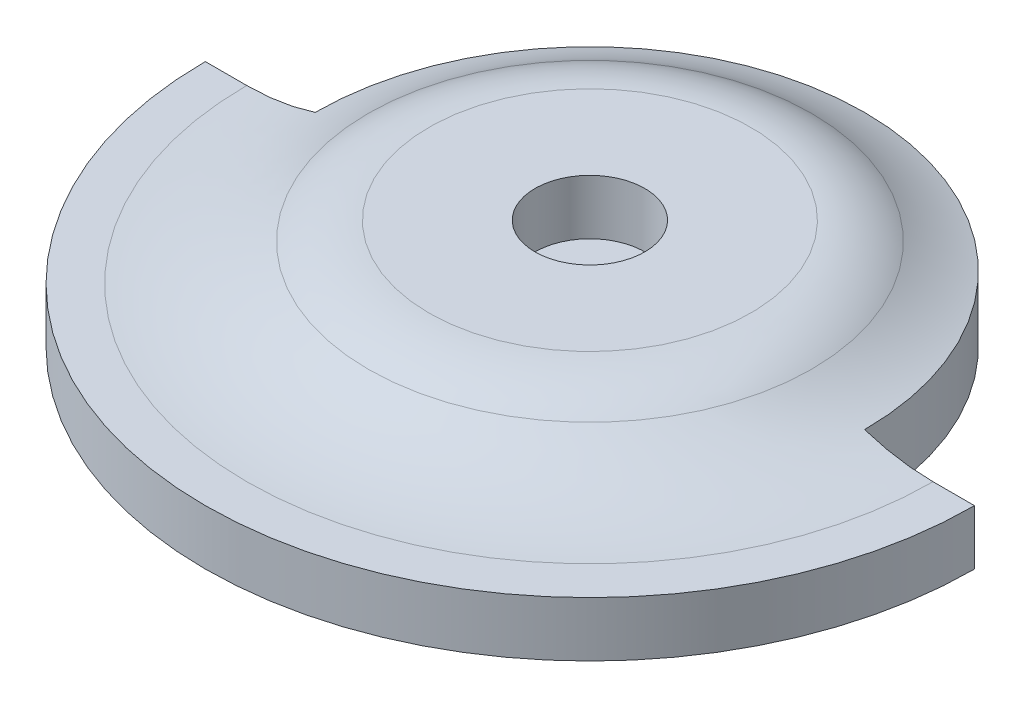
from build123d import *

# Parameters (mm, degrees)
BOSS_EXTRUDE1_DEPTH = 0.5
SKETCH2_R           = 1.8
SKETCH2_R_2         = 0.5
BOSS_EXTRUDE2_DEPTH = 0.5
FILLET2_START       = 0.5
FILLET2_2_DEPTH     = 0.5
FILLET3_R           = 1


with BuildPart() as part:
    # Sketch1 → Boss-Extrude1 (new body)
    with BuildSketch(Plane(origin=(0, 0, 0), x_dir=(1, 0, 0), z_dir=(0, 1, 0))):
        with BuildLine():
            Line((-3.5, 0), (-2.5, 0))
            ThreePointArc((-2.5, 0), (0, 2.5), (2.5, 0))
            Line((2.5, 0), (3.5, 0))
            ThreePointArc((3.5, 0), (0, -3.5), (-3.5, 0))
        make_face()
    extrude(amount=BOSS_EXTRUDE1_DEPTH)

    # Sketch2 → Boss-Extrude2 (add)
    with BuildSketch(Plane(origin=(0, 0.5, 0), x_dir=(1, 0, 0), z_dir=(0, 1, 0))):
        with Locations(Location((0, 0, 0), (0, 0, 270))):
            Circle(SKETCH2_R)
        with Locations(Location((0, 0, 0), (0, 0, 270))):
            Circle(SKETCH2_R_2, mode=Mode.SUBTRACT)
    extrude(amount=BOSS_EXTRUDE2_DEPTH)

    # Fillet2: read off the stored shape, not the designer's step
    # Fillet2 outline → Fillet2 (revolve)
    with BuildSketch(Plane.XY):
        with BuildLine():
            ThreePointArc((3.122875656, 0.5), (2.415768875, 0.629171307), (1.8, 1))
            Line((1.8, 1), (1.8, 0.5))
            Line((1.8, 0.5), (3.122875656, 0.5))
        make_face()
    revolve(axis=Axis((0, 0, 0), (0, 1, 0)))

    # Fillet2 2 outline → Fillet2 2 (cut)
    with BuildSketch(Plane(origin=(0, 0, 0), x_dir=(1, 0, 0), z_dir=(0, 1, 0)).offset(FILLET2_START)):
        with BuildLine():
            ThreePointArc((-2.5, 0), (0, 2.5), (2.5, 0))
            Line((2.5, 0), (5, 0))
            Line((5, 0), (5, 5))
            Line((5, 5), (-5, 5))
            Line((-5, 5), (-5, 0))
            Line((-5, 0), (-2.5, 0))
        make_face()
    extrude(amount=FILLET2_2_DEPTH, mode=Mode.SUBTRACT)

    # Fillet3
    fillet3_edges = [part.edges().sort_by_distance(p)[0] for p in [
        (-1.8, 1, 0),
    ]]
    fillet(fillet3_edges, radius=FILLET3_R)


solid = part.part
